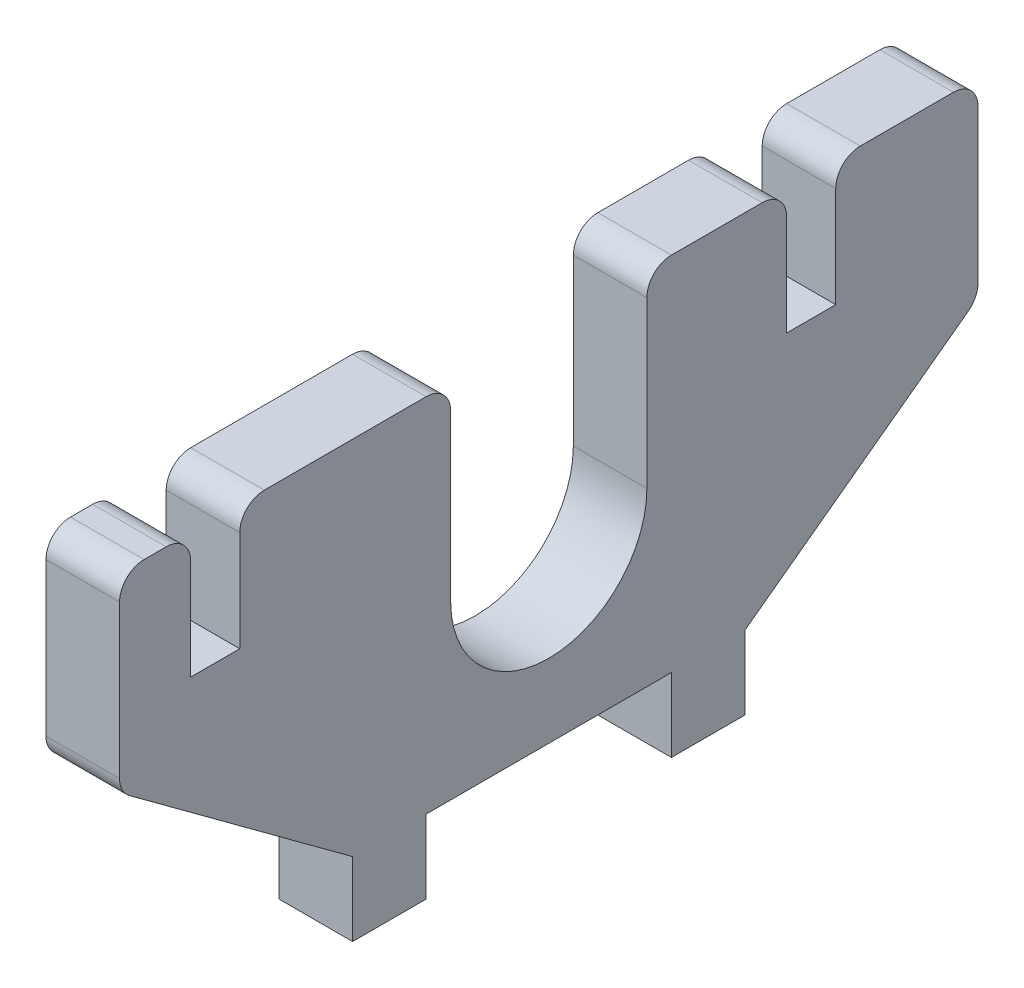
from build123d import *

# Parameters (mm, degrees)
BOSS_EXTRUDE1_DEPTH             = 15
BOSS_EXTRUDE2_REACH             = 1239.023
BOSS_EXTRUDE2_DIRECTION_2_REACH = 1239.023
CUT_EXTRUDE2_DEPTH              = 1238.578280352
CUT_EXTRUDE2_DEPTH_BACK         = 1238.578280352
SKETCH5_W                       = 40
SKETCH5_H                       = 40
CUT_EXTRUDE3_DEPTH              = 1238.578280352
BOSS_EXTRUDE4_DEPTH             = 75
CUT_EXTRUDE4_DEPTH              = 1241.107934819
CUT_EXTRUDE4_DEPTH_BACK         = 1241.107934819
SKETCH8_W                       = 15
SKETCH8_H                       = 73.7
FILLET1_R                       = 5
CUT_EXTRUDE5_DEPTH              = 1241.107934819
CUT_EXTRUDE5_DEPTH_BACK         = 1241.107934819
SKETCH9_W                       = 1635
SKETCH9_H                       = 600
SKETCH10_W                      = 50
SKETCH10_H                      = 15
CUT_EXTRUDE6_DEPTH              = 126.494780768


with BuildPart() as part:
    # Sketch1 → Boss-Extrude1 (new body)
    with BuildSketch(Plane(origin=(0, 0, 0), x_dir=(1, 0, 0), z_dir=(0, 1, 0))):
        Polygon((-450, 300), (-400, 300), (-200, 250), (600, 40), (1200, 40), (1200, -40), (600, -40), (-200, -250), (-400, -300), (-450, -300), align=None)
    extrude(amount=BOSS_EXTRUDE1_DEPTH)

    # Boss-Extrude2: up to this face of the body (flat: up to its plane)
    boss_extrude2_end = Plane(part.part.faces().sort_by_distance((-425, 7.5, 300))[0])
    # Sketch2 → Boss-Extrude2 (add, up to the picked face)
    with BuildSketch(Plane.XY, mode=Mode.PRIVATE) as boss_extrude2_sk1:
        with BuildLine():
            Line((-425, 0), (-450, 0))
            Line((-450, 0), (-450, -40))
            Line((-450, -40), (-440, -40))
            Line((-440, -40), (-440, -15))
            ThreePointArc((-440, -15), (-435.606601718, -4.393398282), (-425, 0))
        make_face()
    boss_extrude2_tool1 = split(extrude(boss_extrude2_sk1.sketch, amount=BOSS_EXTRUDE2_REACH, mode=Mode.PRIVATE), bisect_by=boss_extrude2_end, keep=Keep.BOTH, mode=Mode.PRIVATE)
    # Sketch2 → Boss-Extrude2 (add, up to the picked face)
    with BuildSketch(Plane.XY, mode=Mode.PRIVATE) as boss_extrude2_sk2:
        with BuildLine():
            Line((-400, 0), (-425, 0))
            ThreePointArc((-425, 0), (-414.393398282, -4.393398282), (-410, -15))
            Line((-410, -15), (-410, -40))
            Line((-410, -40), (-400, -40))
            Line((-400, -40), (-400, 0))
        make_face()
    boss_extrude2_tool2 = split(extrude(boss_extrude2_sk2.sketch, amount=BOSS_EXTRUDE2_REACH, mode=Mode.PRIVATE), bisect_by=boss_extrude2_end, keep=Keep.BOTH, mode=Mode.PRIVATE)
    add(boss_extrude2_tool1.solids().sort_by(Axis((-444.100555, -18.206662, 0), (0, 0, 1)))[0])
    add(boss_extrude2_tool2.solids().sort_by(Axis((-405.899445, -18.206662, 0), (0, 0, 1)))[0])

    # Boss-Extrude2 direction 2: up to this face of the body (flat: up to its plane)
    boss_extrude2_direction_2_end = Plane(part.part.faces().sort_by_distance((-425, 7.5, -300))[0])
    # Sketch2 → Boss-Extrude2 direction 2 (add, up to the picked face)
    with BuildSketch(Plane.XY, mode=Mode.PRIVATE) as boss_extrude2_direction_2_sk1:
        with BuildLine():
            Line((-425, 0), (-450, 0))
            Line((-450, 0), (-450, -40))
            Line((-450, -40), (-440, -40))
            Line((-440, -40), (-440, -15))
            ThreePointArc((-440, -15), (-435.606601718, -4.393398282), (-425, 0))
        make_face()
    boss_extrude2_direction_2_tool1 = split(extrude(boss_extrude2_direction_2_sk1.sketch, amount=-BOSS_EXTRUDE2_DIRECTION_2_REACH, mode=Mode.PRIVATE), bisect_by=boss_extrude2_direction_2_end, keep=Keep.BOTH, mode=Mode.PRIVATE)
    # Sketch2 → Boss-Extrude2 direction 2 (add, up to the picked face)
    with BuildSketch(Plane.XY, mode=Mode.PRIVATE) as boss_extrude2_direction_2_sk2:
        with BuildLine():
            Line((-400, 0), (-425, 0))
            ThreePointArc((-425, 0), (-414.393398282, -4.393398282), (-410, -15))
            Line((-410, -15), (-410, -40))
            Line((-410, -40), (-400, -40))
            Line((-400, -40), (-400, 0))
        make_face()
    boss_extrude2_direction_2_tool2 = split(extrude(boss_extrude2_direction_2_sk2.sketch, amount=-BOSS_EXTRUDE2_DIRECTION_2_REACH, mode=Mode.PRIVATE), bisect_by=boss_extrude2_direction_2_end, keep=Keep.BOTH, mode=Mode.PRIVATE)
    add(boss_extrude2_direction_2_tool1.solids().sort_by(Axis((-444.100555, -18.206662, 0), (0, 0, -1)))[0])
    add(boss_extrude2_direction_2_tool2.solids().sort_by(Axis((-405.899445, -18.206662, 0), (0, 0, -1)))[0])

    # Sketch4 → Cut-Extrude2 (cut, two sides: drawn at the far end of the back side and taken through both)
    with BuildSketch(Plane(origin=(0, 0, 0), x_dir=(1, 0, 0), z_dir=(0, 1, 0)).offset(-CUT_EXTRUDE2_DEPTH_BACK)):
        Polygon((-450, 230), (-400, 230), (-150, 167.5), (-150, -167.5), (-400, -230), (-450, -230), align=None)
        Polygon((-100, 155), (-100, -155), (520, 0), align=None)
    extrude(amount=CUT_EXTRUDE2_DEPTH + CUT_EXTRUDE2_DEPTH_BACK, mode=Mode.SUBTRACT)

    # Sketch5 → Cut-Extrude3 (cut, through all)
    with BuildSketch(Plane(origin=(0, 0, 0), x_dir=(0, 0, -1), z_dir=(1, 0, 0))):
        with Locations((-265, -20)):
            Rectangle(SKETCH5_W, SKETCH5_H)
        with Locations((265, -20)):
            Rectangle(SKETCH5_W, SKETCH5_H)
    extrude(amount=-CUT_EXTRUDE3_DEPTH, mode=Mode.SUBTRACT)

    # Sketch7 → Boss-Extrude4 (add)
    with BuildSketch(Plane(origin=(1200, 0, 0), x_dir=(0, 0, -1), z_dir=(1, 0, 0))):
        with BuildLine():
            Line((-87.5, 50), (-40, 15))
            Line((-40, 15), (40, 15))
            Line((40, 15), (87.5, 50))
            Line((87.5, 50), (87.5, 88.7))
            Line((87.5, 88.7), (58.5, 88.7))
            Line((58.5, 88.7), (58.5, 63.2))
            Line((58.5, 63.2), (48.5, 63.2))
            Line((48.5, 63.2), (48.5, 88.7))
            Line((48.5, 88.7), (20, 88.7))
            Line((20, 88.7), (20, 50))
            ThreePointArc((20, 50), (0, 30), (-20, 50))
            Line((-20, 50), (-20, 88.7))
            Line((-20, 88.7), (-63, 88.7))
            Line((-63, 88.7), (-63, 63.2))
            Line((-63, 63.2), (-73, 63.2))
            Line((-73, 63.2), (-73, 88.7))
            Line((-73, 88.7), (-87.5, 88.7))
            Line((-87.5, 88.7), (-87.5, 50))
        make_face()
    extrude(amount=-BOSS_EXTRUDE4_DEPTH)

    # Sketch8 → Cut-Extrude4 (cut, two sides: drawn at the far end of the back side and taken through both)
    with BuildSketch(Plane.XY.offset(-CUT_EXTRUDE4_DEPTH_BACK)):
        with Locations((1147.5, 51.85)):
            Rectangle(SKETCH8_W, SKETCH8_H)
        with Locations((1177.5, 51.85)):
            Rectangle(SKETCH8_W, SKETCH8_H)
    extrude(amount=CUT_EXTRUDE4_DEPTH + CUT_EXTRUDE4_DEPTH_BACK, mode=Mode.SUBTRACT)

    # Fillet1
    fillet1_edges = [part.edges().sort_by_distance(p)[0] for p in [
        (1192.5, 50, 87.5),
        (1162.5, 50, 87.5),
        (1132.5, 50, 87.5),
        (1192.5, 50, -87.5),
        (1162.5, 50, -87.5),
        (1132.5, 50, -87.5),
        (1192.5, 88.7, -87.5),
        (1162.5, 88.7, -87.5),
        (1132.5, 88.7, -87.5),
        (1132.5, 88.7, -58.5),
        (1162.5, 88.7, -58.5),
        (1192.5, 88.7, -58.5),
        (1192.5, 88.7, -48.5),
        (1162.5, 88.7, -48.5),
        (1132.5, 88.7, -48.5),
        (1192.5, 88.7, -20),
        (1162.5, 88.7, -20),
        (1132.5, 88.7, -20),
        (1192.5, 88.7, 63),
        (1162.5, 88.7, 63),
        (1132.5, 88.7, 63),
        (1132.5, 88.7, 87.5),
        (1162.5, 88.7, 87.5),
        (1192.5, 88.7, 87.5),
        (1192.5, 88.7, 73),
        (1162.5, 88.7, 73),
        (1132.5, 88.7, 73),
        (1192.5, 88.7, 20),
        (1162.5, 88.7, 20),
        (1132.5, 88.7, 20),
        (600, 7.5, 40),
        (600, 7.5, -40),
        (520, 7.5, 0),
        (-440, -40, -292.5),
        (-440, -40, -237.5),
        (-400, -40, -292.5),
        (-400, -40, -237.5),
        (-450, -40, -237.5),
        (-410, -40, -237.5),
        (-450, -40, -292.5),
        (-410, -40, -292.5),
        (-150, 7.5, 167.5),
        (-100, 7.5, 155),
        (-150, 7.5, -167.5),
        (-100, 7.5, -155),
        (-450, -40, 237.5),
        (-410, -40, 237.5),
        (-440, -40, 237.5),
        (-400, -40, 237.5),
        (-450, -40, 292.5),
        (-440, -40, 292.5),
        (-400, -40, 292.5),
        (-410, -40, 292.5),
    ]]
    fillet(fillet1_edges, radius=FILLET1_R - 0.0001)  # a hair under: the kernel refuses the full size

    # Sketch9 → Cut-Extrude5 (cut, two sides: drawn at the far end of the back side and taken through both)
    with BuildSketch(Plane(origin=(0, 0, 0), x_dir=(1, 0, 0), z_dir=(0, 1, 0)).offset(-CUT_EXTRUDE5_DEPTH_BACK)):
        with Locations((367.5, 0)):
            Rectangle(SKETCH9_W, SKETCH9_H)
    extrude(amount=CUT_EXTRUDE5_DEPTH + CUT_EXTRUDE5_DEPTH_BACK, mode=Mode.SUBTRACT)

    # Sketch10 → Cut-Extrude6 (cut, through all)
    with BuildSketch(Plane(origin=(1200, 0, 0), x_dir=(0, 0, -1), z_dir=(1, 0, 0))):
        with Locations((0, 7.5)):
            Rectangle(SKETCH10_W, SKETCH10_H)
    extrude(amount=-CUT_EXTRUDE6_DEPTH, mode=Mode.SUBTRACT)


solid = part.part
